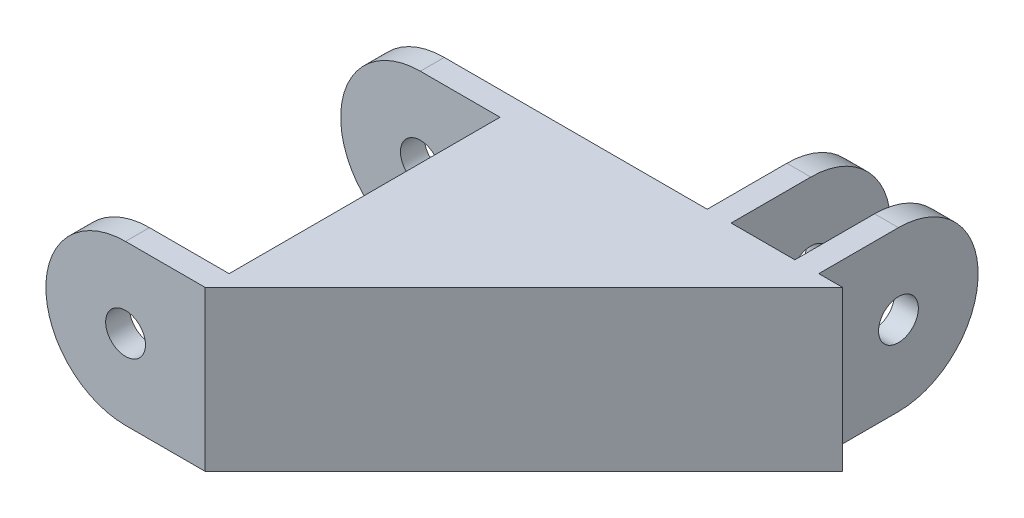
from build123d import *

# Parameters (mm, degrees)
BOSS_EXTRUDE1_DEPTH = 10
BOSS_EXTRUDE2_START = 37
BOSS_EXTRUDE2_DEPTH = 3
LPATTERN1_COUNT     = 2
LPATTERN1_PITCH     = 11
SKETCH3_R           = 2.5
CUT_EXTRUDE1_DEPTH  = 40
SKETCH4_R           = 2.5
BOSS_EXTRUDE3_DEPTH = 3
LPATTERN2_COUNT     = 2
LPATTERN2_PITCH     = 37
SHELL2_START        = -8
SHELL2_DEPTH        = 16


# Read off the part's stored shape, not the designer's step: Shell2
with BuildPart() as part:
    # Sketch1 → Boss-Extrude1 (new, symmetric)
    with BuildSketch(Plane(origin=(0, 0, 0), x_dir=(1, 0, 0), z_dir=(0, 1, 0))):
        Polygon((0, 0), (0, 40), (40, 40), align=None)
    extrude(amount=BOSS_EXTRUDE1_DEPTH, both=True)

    # Sketch2 → Boss-Extrude2 (add)
    with BuildSketch(Plane(origin=(0, 0, 0), x_dir=(0, 0, -1), z_dir=(1, 0, 0)).offset(BOSS_EXTRUDE2_START)):
        with BuildLine():
            Line((40, 10), (50, 10))
            ThreePointArc((50, 10), (60, 0), (50, -10))
            Line((50, -10), (40, -10))
            Line((40, -10), (40, 10))
        make_face()
    boss_extrude2 = extrude(amount=-BOSS_EXTRUDE2_DEPTH)

    # LPattern1: Boss-Extrude2 ×2
    with Locations(*[(-i * LPATTERN1_PITCH, 0, 0) for i in range(1, LPATTERN1_COUNT)]):
        add(boss_extrude2)

    # Sketch3 → Cut-Extrude1 (cut)
    with BuildSketch(Plane(origin=(0, 0, 0), x_dir=(0, 0, -1), z_dir=(1, 0, 0))):
        with Locations((50, 0)):
            Circle(SKETCH3_R)
    extrude(amount=CUT_EXTRUDE1_DEPTH, mode=Mode.SUBTRACT)

    # Sketch4 → Boss-Extrude3 (add)
    with BuildSketch(Plane.XY):
        with BuildLine():
            Line((0, 10), (-10, 10))
            ThreePointArc((-10, 10), (-20, 0), (-10, -10))
            Line((-10, -10), (0, -10))
            Line((0, -10), (0, 10))
        make_face()
        with Locations((-10, 0)):
            Circle(SKETCH4_R, mode=Mode.SUBTRACT)
    boss_extrude3 = extrude(amount=-BOSS_EXTRUDE3_DEPTH)

    # LPattern2: Boss-Extrude3 ×2
    with Locations(*[(0, 0, -i * LPATTERN2_PITCH) for i in range(1, LPATTERN2_COUNT)]):
        add(boss_extrude3)

    # Shell2 outline → Shell2 (cut)
    with BuildSketch(Plane(origin=(0, 0, 0), x_dir=(1, 0, 0), z_dir=(0, 1, 0)).offset(SHELL2_START)):
        Polygon((35, 40), (25, 40), (25, 38), (0, 38), (0, 2.828427125), (35.171572875, 38), (35, 38), align=None)
    extrude(amount=SHELL2_DEPTH, mode=Mode.SUBTRACT)


solid = part.part
